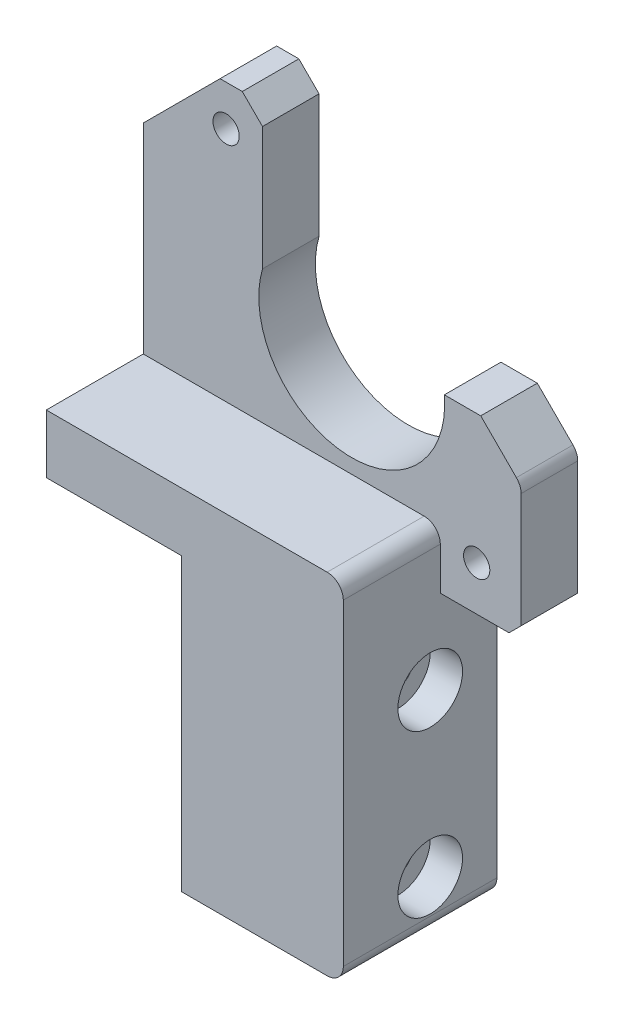
from build123d import *

# Parameters (mm, degrees)
BOSS_EXTRUDE1_DEPTH = 19
BOSS_EXTRUDE2_DEPTH = 7
SKETCH3_R           = 1.75
CUT_EXTRUDE1_DEPTH  = 88.851081382
SKETCH6_R           = 4
CUT_EXTRUDE4_DEPTH  = 4
SKETCH7_R           = 1.625
CUT_EXTRUDE5_DEPTH  = 86.248167136
FILLET1_R           = 2


with BuildPart() as part:
    # Sketch1 → Boss-Extrude1 (new body)
    with BuildSketch(Plane.XY):
        Polygon((0, 0), (20, 0), (20, 43.25), (-16.75, 43.25), (-16.75, 36), (0, 36), align=None)
    extrude(amount=BOSS_EXTRUDE1_DEPTH)

    # Sketch2 → Boss-Extrude2 (add)
    with BuildSketch(Plane(origin=(0, 0, 0), x_dir=(-1, 0, 0), z_dir=(0, 0, -1))):
        with BuildLine():
            Line((-20, 36), (16.75, 36))
            Line((16.75, 36), (16.75, 68))
            Line((16.75, 68), (7.25, 77.5))
            Line((7.25, 77.5), (4.5, 77.5))
            Line((4.5, 77.5), (2, 75))
            Line((2, 75), (2, 59.75))
            ThreePointArc((2, 59.75), (-7.896468276, 45.089682755), (-20.5, 57.5))
            Line((-20.5, 57.5), (-25, 57.5))
            Line((-25, 57.5), (-30, 52.5))
            Line((-30, 52.5), (-30, 37.5))
            Line((-30, 37.5), (-28.5, 36))
            Line((-28.5, 36), (-20, 36))
        make_face()
    extrude(amount=-BOSS_EXTRUDE2_DEPTH)

    # Sketch3 → Cut-Extrude1 (cut, through all)
    with BuildSketch(Plane(origin=(20, 0, 0), x_dir=(0, 0, -1), z_dir=(1, 0, 0))):
        with Locations((-8.25, 26.25)):
            Circle(SKETCH3_R)
        with Locations((-8.25, 6.25)):
            Circle(SKETCH3_R)
    extrude(amount=-CUT_EXTRUDE1_DEPTH, mode=Mode.SUBTRACT)

    # Sketch6 → Cut-Extrude4 (cut)
    with BuildSketch(Plane(origin=(20, 0, 0), x_dir=(0, 0, -1), z_dir=(1, 0, 0))):
        with Locations((-8.25, 26.25)):
            Circle(SKETCH6_R)
        with Locations((-8.25, 6.25)):
            Circle(SKETCH6_R)
    extrude(amount=-CUT_EXTRUDE4_DEPTH, mode=Mode.SUBTRACT)

    # Sketch7 → Cut-Extrude5 (cut, through all)
    with BuildSketch(Plane(origin=(0, 0, 0), x_dir=(-1, 0, 0), z_dir=(0, 0, -1))):
        with Locations((6.5, 72.5)):
            Circle(SKETCH7_R)
        with Locations((-24.5, 41.5)):
            Circle(SKETCH7_R)
    extrude(amount=-CUT_EXTRUDE5_DEPTH, mode=Mode.SUBTRACT)

    # Fillet1
    fillet1_edges = [part.edges().sort_by_distance(p)[0] for p in [
        (20, 43.25, 13),
        (30, 52.5, 3.5),
        (20, 0, 9.5),
    ]]
    fillet(fillet1_edges, radius=FILLET1_R)


solid = part.part
